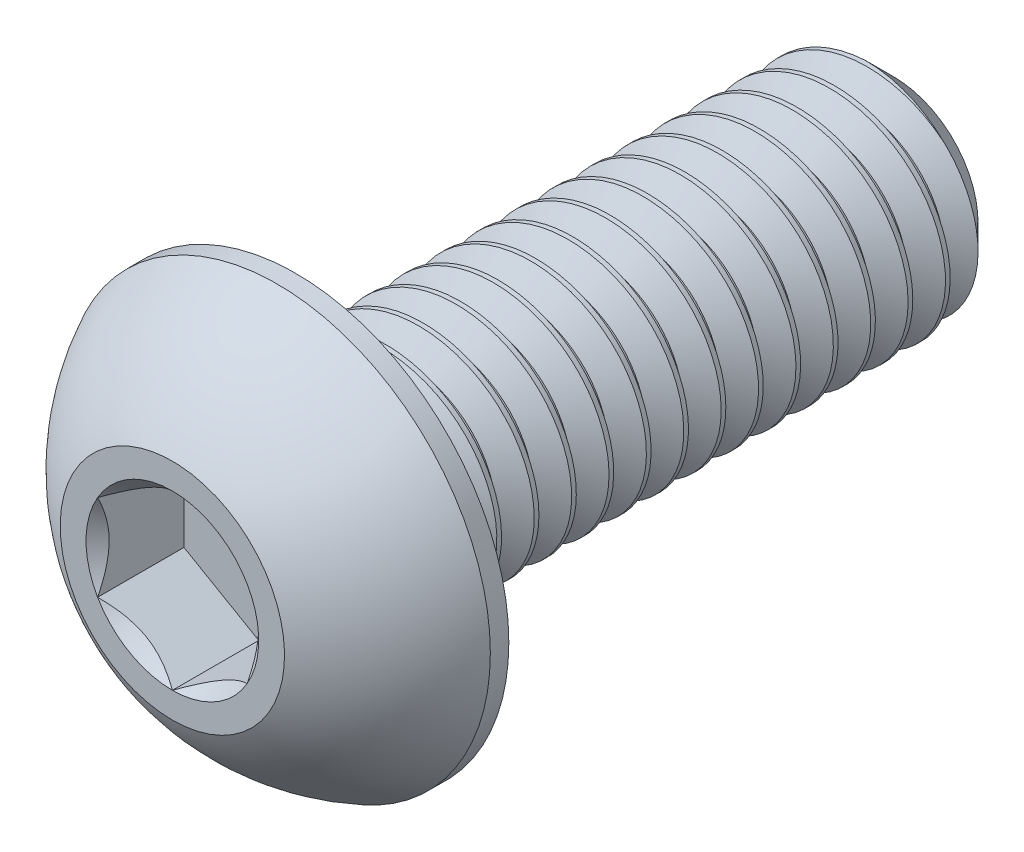
from build123d import *

# Parameters (mm, degrees)
SKETCH1_W          = 8
SKETCH1_H          = 1.5
CHAMFER1_SIZE      = 0.375
CUT_EXTRUDE2_DEPTH = 1.155
CUT_SWEEP1_PITCH   = 0.5


with BuildPart() as part:
    # Sketch1 → Revolve1 (revolve)
    with BuildSketch(Plane(origin=(0, 0, 0), x_dir=(0, 0, -1), z_dir=(1, 0, 0))):
        with Locations((5.65, 0.75)):
            Rectangle(SKETCH1_W, SKETCH1_H)
    revolve(axis=Axis((0, 0, -9.65), (0, 0, 1)))

    # Chamfer1
    chamfer1_edges = [part.edges().sort_by_distance(p)[0] for p in [
        (0, -1.5, -9.65),
    ]]
    chamfer(chamfer1_edges, length=CHAMFER1_SIZE)

    # Sketch7 → Revolve2 (revolve)
    with BuildSketch(Plane(origin=(0, 0, 0), x_dir=(0, 0, -1), z_dir=(1, 0, 0)), mode=Mode.PRIVATE) as revolve2_sk:
        with BuildLine():
            Line((1.4025, 2.85), (1.65, 2.85))
            Line((1.65, 2.85), (1.65, 0))
            Line((1.65, 0), (0, 0))
            Line((0, 0), (0, 1.5))
            ThreePointArc((0, 1.5), (0.59512511, 2.285251969), (1.4025, 2.85))
        make_face()
    revolve(revolve2_sk.sketch.rotate(Axis((0, 0, 0), (0, 0, -1)), 180), axis=Axis((0, 0, 0), (0, 0, -1)))

    # Sketch5 → Cut-Extrude2 (cut)
    with BuildSketch(Plane.XY):
        Polygon((1, -0.577350269), (1, 0.577350269), (0, 1.154700538), (-1, 0.577350269), (-1, -0.577350269), (0, -1.154700538), align=None)
    extrude(amount=-CUT_EXTRUDE2_DEPTH, mode=Mode.SUBTRACT)

    # Cut-Extrude3 cone 1 section (through the dimple's axis) → Cut-Extrude3 (revolve, cut)
    with BuildSketch(Plane(origin=(0, 0, 0), x_dir=(0, -1, 0), z_dir=(1, 0, 0))):
        Polygon((0, 0), (1.154700538, 0), (0, 1.154700538), align=None)
    revolve(axis=Axis((0, 0, 0), (0, 0, -1)), mode=Mode.SUBTRACT)

    # Cut-Sweep1: the profile of Sketch2 profile screwed along a right-hand helix of 17 turns, 6 arcs to a turn; built about Z, then put on its axis
    cut_sweep1_z = Axis((0, 0, 0), (0, 0, 1))
    cut_sweep1_corners = [(1.5003, 0, 0.375173205), (1.5003, 0, -0.062673205), (1.175240474, 0, 0.125), (1.175240474, 0, 0.1875)]
    with BuildLine(mode=Mode.PRIVATE) as cut_sweep1_profile:
        Line(cut_sweep1_corners[0], cut_sweep1_corners[1])
        Line(cut_sweep1_corners[1], cut_sweep1_corners[2])
        Line(cut_sweep1_corners[2], cut_sweep1_corners[3])
        Line(cut_sweep1_corners[3], cut_sweep1_corners[0])
    cut_sweep1_cap = Face(cut_sweep1_profile.wire())
    cut_sweep1_turn_angles = [0, 30, 60, 90, 120, 150, 180, 210, 240, 270, 300, 330, 360]
    cut_sweep1_turn_weights = [1, 0.8660254037844387, 1, 0.8660254037844387, 1, 0.8660254037844387, 1, 0.8660254037844387, 1, 0.8660254037844387, 1, 0.8660254037844387, 1]
    cut_sweep1_turn_rails = [Edge.make_bspline([Vector(p[0], p[1], 0).rotate(cut_sweep1_z, cut_sweep1_turn_angles[k]) / cut_sweep1_turn_weights[k] + Vector(0, 0, p[2] + CUT_SWEEP1_PITCH * cut_sweep1_turn_angles[k] / 360) for k in range(13)], [0, 0, 0, 1, 1, 2, 2, 3, 3, 4, 4, 5, 5, 6, 6, 6], 2, cut_sweep1_turn_weights) for p in cut_sweep1_corners]
    cut_sweep1_turn_sides = [Face.make_surface_from_curves(cut_sweep1_turn_rails[p[0]], cut_sweep1_turn_rails[p[1]]) for p in [(0, 1), (1, 2), (2, 3), (3, 0)]]
    cut_sweep1 = Plane(origin=(0, 0, -9.65), x_dir=(0, 1, 0), z_dir=(0, 0, 1)) * Solid(Shell([*[p.moved(Location((0, 0, CUT_SWEEP1_PITCH * i))) for i in range(17) for p in cut_sweep1_turn_sides], cut_sweep1_cap, cut_sweep1_cap.rotate(cut_sweep1_z, 6120).moved(Location((0, 0, CUT_SWEEP1_PITCH * 6120 / 360)))]))
    add(cut_sweep1, mode=Mode.SUBTRACT)


solid = part.part
